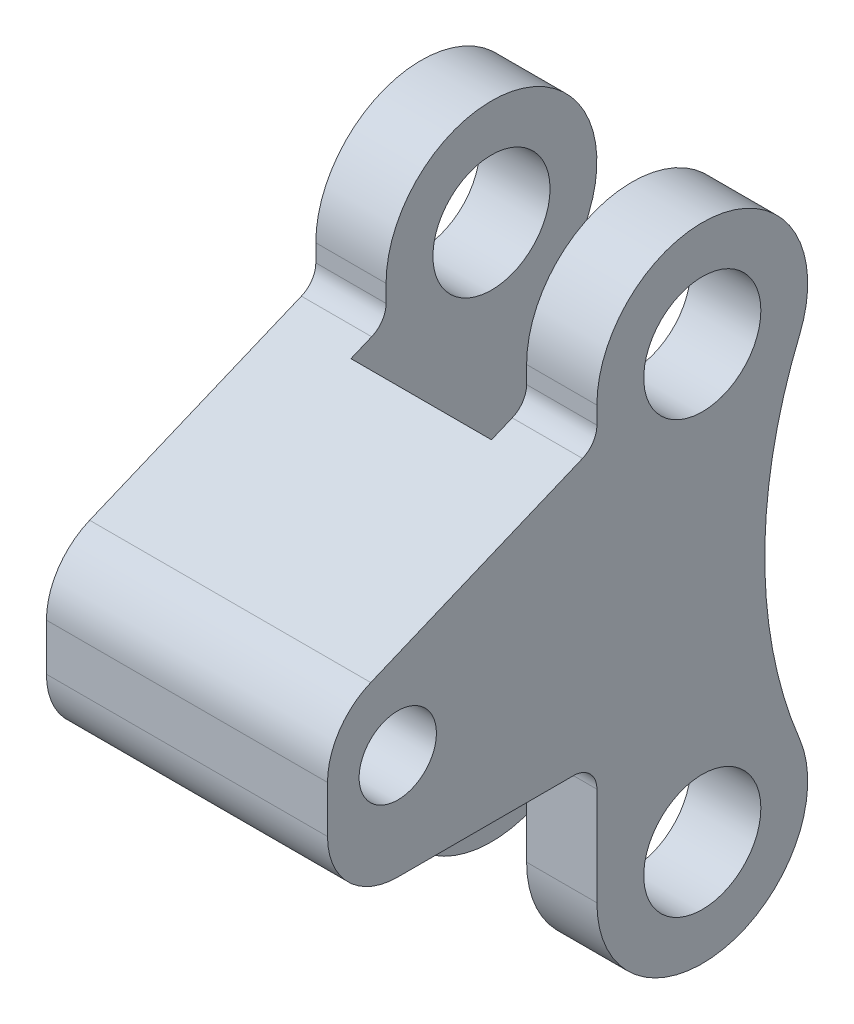
from build123d import *

# Parameters (mm, degrees)
EXTRUDE_1_DEPTH     = 22
SKETCH_2_W          = 32.061557032
SKETCH_2_H          = 43.504749412
CUT_EXTRUDE_1_DEPTH = 16
SKETCH_3_W          = 6
SKETCH_3_H          = 10.337049688
CUT_EXTRUDE_2_DEPTH = 30
SKETCH_9_R          = 2.5
CUT_EXTRUDE_4_DEPTH = 37.263066611
HOLE_WIZARD_M4_1_D  = 3.3
CHAMFER_1_SIZE      = 12
CHAMFER_1_SIZE_2    = 5
FILLET_2_R          = 3
FILLET_3_R          = 3
FILLET_4_R          = 1


with BuildPart() as part:
    # 草圖1 → 填料-伸長1 (new body)
    with BuildSketch(Plane.XY):
        Polygon((0, 0), (3, 0), (3, 9.7), (9, 9.7), (9, 0), (12, 0), (12, 27.4), (9, 27.4), (9, 21.7), (3, 21.7), (3, 27.4), (0, 27.4), align=None)
    extrude(amount=EXTRUDE_1_DEPTH)

    # 草圖2 → 除料-伸長1 (cut)
    with BuildSketch(Plane(origin=(0, 0, 0), x_dir=(0, 0, -1), z_dir=(1, 0, 0))):
        with Locations((-6.749670429, 14.217142955)):
            Rectangle(SKETCH_2_W, SKETCH_2_H)
        with BuildLine():
            Line((-20.5, 9.7), (-10, 9.7))
            ThreePointArc((-10, 9.7), (-9.292893219, 9.407106781), (-9, 8.7))
            Line((-9, 8.7), (-9, 4.5))
            ThreePointArc((-9, 4.5), (-3.620541034, 0.086775337), (-0.343754699, 6.225))
            ThreePointArc((-0.343754699, 6.225), (-1.833358396, 13.7), (-0.343754699, 21.175))
            ThreePointArc((-0.343754699, 21.175), (-3.620541034, 27.313224663), (-9, 22.9))
            Line((-9, 22.9), (-9, 21.7))
            Line((-9, 21.7), (-20.5, 21.7))
            Line((-20.5, 21.7), (-20.5, 9.7))
        make_face(mode=Mode.SUBTRACT)
    extrude(amount=CUT_EXTRUDE_1_DEPTH, mode=Mode.SUBTRACT)

    # 草圖3 → 除料-伸長2 (cut)
    with BuildSketch(Plane(origin=(0, 0, 0), x_dir=(1, 0, 0), z_dir=(0, 1, 0))):
        with Locations((6, -5.331475156)):
            Rectangle(SKETCH_3_W, SKETCH_3_H)
    extrude(amount=CUT_EXTRUDE_2_DEPTH, mode=Mode.SUBTRACT)

    # 草圖9 → 除料-伸長4 (cut, through all)
    with BuildSketch(Plane(origin=(12, 0, 0), x_dir=(0, 0, -1), z_dir=(1, 0, 0))):
        with Locations((-4.5, 4.5)):
            Circle(SKETCH_9_R)
        with Locations((-4.5, 22.9)):
            Circle(SKETCH_9_R)
    extrude(amount=-CUT_EXTRUDE_4_DEPTH, mode=Mode.SUBTRACT)

    # M4 螺紋孔1 (through all)
    with Locations(Plane(origin=(12, 0, 0), x_dir=(0, 0, -1), z_dir=(1, 0, 0))):
        with Locations((-17.5, 14.2)):
            Hole(HOLE_WIZARD_M4_1_D / 2)

    # 導角1
    # the kernel refuses this chamfer: 12, 5 mm, written as the material it takes off along each edge
    with BuildSketch(Plane(origin=(43.111115995, 21.7, 20.5), x_dir=(0, 0.014835162506254055, -0.9998899529215268), z_dir=(-1, 0, 0))) as chamfer_1_piece_1_section:
        Polygon((CHAMFER_1_SIZE * 0.999889952922, CHAMFER_1_SIZE * 0.0148351625063), (-CHAMFER_1_SIZE_2 * 0.0148351625063, CHAMFER_1_SIZE_2 * 0.999889952922), (0, 0), align=None)
    chamfer_1_piece_1 = extrude(amount=74.22223199, mode=Mode.PRIVATE)
    chamfer_1_piece_1 = split(chamfer_1_piece_1, bisect_by=Plane(origin=(10.5, 21.408333333, 9), z_dir=(0, 0, 1)), keep=Keep.TOP, mode=Mode.PRIVATE)
    add(chamfer_1_piece_1, mode=Mode.SUBTRACT)

    # 圓角2
    fillet_2_edges = [part.edges().sort_by_distance(p)[0] for p in [
        (6, 9.7, 20.5),
    ]]
    fillet(fillet_2_edges, radius=FILLET_2_R)

    # 圓角3
    fillet_3_edges = [part.edges().sort_by_distance(p)[0] for p in [
        (6, 16.7, 20.5),
    ]]
    fillet(fillet_3_edges, radius=FILLET_3_R)

    # 圓角4
    fillet_4_edges = [part.edges().sort_by_distance(p)[0] for p in [
        (1.5, 21.491666667, 9),
        (10.5, 21.491666667, 9),
    ]]
    fillet(fillet_4_edges, radius=FILLET_4_R)


solid = part.part
